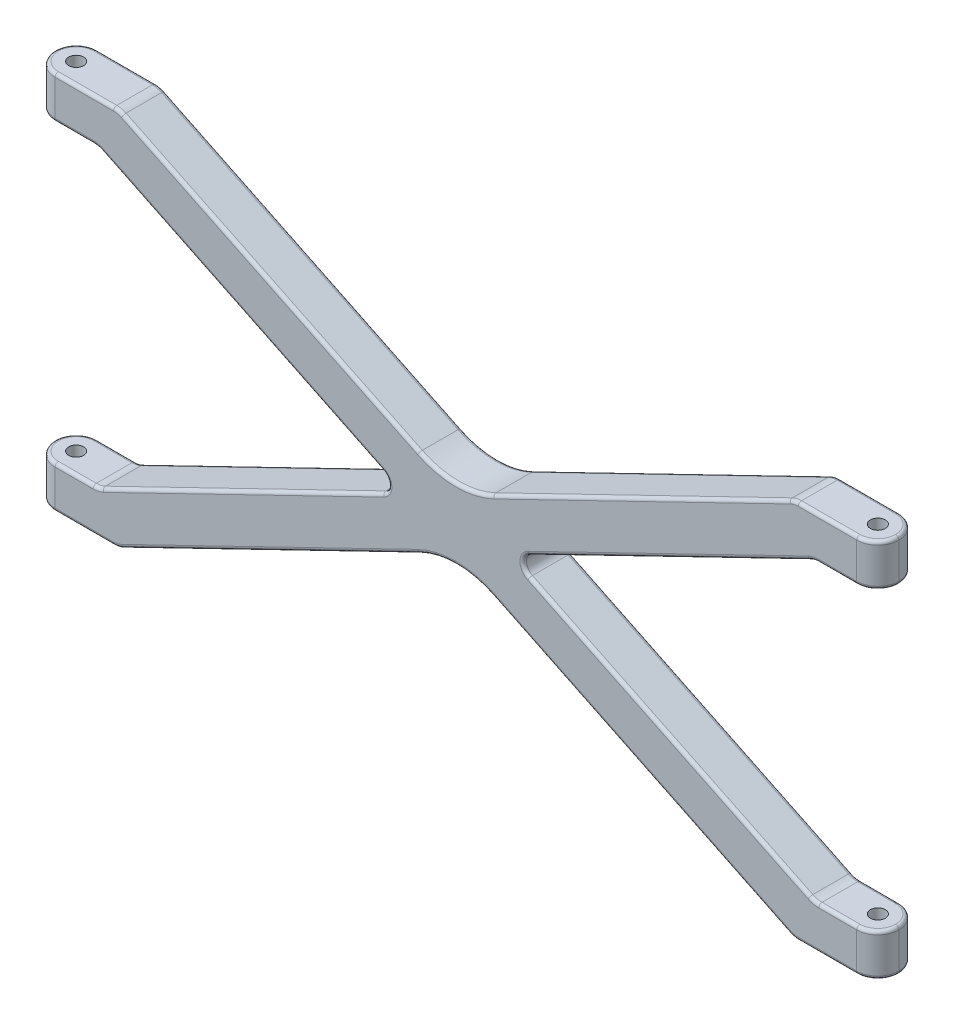
from build123d import *

# Parameters (mm, degrees)
BOSS_EXTRUDE1_DEPTH = 12.7
FILLET1_R           = 6.35
SKETCH2_R           = 2.25
CUT_EXTRUDE1_DEPTH  = 172.332367053
FILLET4_R           = 25.4
FILLET5_R           = 3.175
FILLET2_R           = 6.35
FILLET3_R           = 1


with BuildPart() as part:
    # Sketch1 → Boss-Extrude1 (new body)
    with BuildSketch(Plane.XY):
        Polygon((-107.763073453, 44.45), (-16.166728817, 0), (0, 7.845412377), (-101.6, 57.15), (-127, 57.15), (-127, 44.45), align=None)
        Polygon((0, 7.845412377), (16.166728817, 0), (107.763073453, 44.45), (127, 44.45), (127, 57.15), (101.6, 57.15), align=None)
        Polygon((0, -7.845412377), (101.6, -57.15), (127, -57.15), (127, -44.45), (107.763073453, -44.45), (16.166728817, 0), align=None)
        Polygon((-101.6, -57.15), (0, -7.845412377), (-16.166728817, 0), (-107.763073453, -44.45), (-127, -44.45), (-127, -57.15), align=None)
        Polygon((-16.166728817, 0), (0, -7.845412377), (16.166728817, 0), (0, 7.845412377), align=None)
    extrude(amount=BOSS_EXTRUDE1_DEPTH)

    # Fillet1
    fillet1_edges = [part.edges().sort_by_distance(p)[0] for p in [
        (127, -50.8, 0),
        (127, -50.8, 12.7),
        (127, 50.8, 0),
        (127, 50.8, 12.7),
        (-127, 50.8, 0),
        (-127, 50.8, 12.7),
        (-127, -50.8, 0),
        (-127, -50.8, 12.7),
    ]]
    fillet(fillet1_edges, radius=FILLET1_R - 0.0001)  # a hair under: the kernel refuses the full size

    # Sketch2 → Cut-Extrude1 (cut, through all)
    with BuildSketch(Plane.XZ.offset(57.15)):
        with Locations((-120.65, 6.35)):
            Circle(SKETCH2_R)
        with Locations((120.65, 6.35)):
            Circle(SKETCH2_R)
    extrude(amount=-CUT_EXTRUDE1_DEPTH, mode=Mode.SUBTRACT)

    # Fillet4
    fillet4_edges = [part.edges().sort_by_distance(p)[0] for p in [
        (0, 7.845412377, 6.35),
        (0, -7.845412377, 6.35),
    ]]
    fillet(fillet4_edges, radius=FILLET4_R)

    # Fillet5
    fillet5_edges = [part.edges().sort_by_distance(p)[0] for p in [
        (16.166728817, 0, 6.35),
        (-16.166728817, 0, 6.35),
    ]]
    fillet(fillet5_edges, radius=FILLET5_R)

    # Fillet2
    fillet2_edges = [part.edges().sort_by_distance(p)[0] for p in [
        (-101.6, 57.15, 6.35),
        (101.6, 57.15, 6.35),
        (107.763073453, 44.45, 6.35),
        (107.763073453, -44.45, 6.35),
        (101.6, -57.15, 6.35),
        (-101.6, -57.15, 6.35),
        (-107.763073453, -44.45, 6.35),
        (-107.763073453, 44.45, 6.35),
    ]]
    fillet(fillet2_edges, radius=FILLET2_R)

    # Fillet3
    fillet3_edges = [part.edges().sort_by_distance(p)[0] for p in [
        (-55.68820139, 34.869859277, 0),
        (-55.68820139, 34.869859277, 12.7),
        (55.68820139, 34.869859277, 0),
        (55.68820139, 34.869859277, 12.7),
        (0, 10.678263766, 0),
        (0, 10.678263766, 12.7),
        (0, -10.678263766, 0),
        (0, -10.678263766, 12.7),
        (64.25148447, 23.334636303, 0),
        (64.25148447, 23.334636303, 12.7),
        (-64.25148447, 23.334636303, 0),
        (-64.25148447, 23.334636303, 12.7),
        (20.264017866, 0, 0),
        (20.264017866, 0, 12.7),
        (-20.264017866, 0, 0),
        (-20.264017866, 0, 12.7),
        (-55.68820139, -34.869859277, 0),
        (-55.68820139, -34.869859277, 12.7),
        (111.854743004, -57.15, 0),
        (55.68820139, -34.869859277, 0),
        (-111.854743004, -57.15, 0),
        (-64.25148447, -23.334636303, 0),
        (-111.854743004, 57.15, 0),
        (111.854743004, 57.15, 0),
        (64.25148447, -23.334636303, 0),
        (-101.637079319, 56.988662512, 0),
        (101.637079319, 56.988662512, 0),
        (101.637079319, -56.988662512, 0),
        (-101.637079319, -56.988662512, 0),
        (-111.854743004, -57.15, 12.7),
        (111.854743004, -57.15, 12.7),
        (64.25148447, -23.334636303, 12.7),
        (111.854743004, 57.15, 12.7),
        (-111.854743004, 57.15, 12.7),
        (-64.25148447, -23.334636303, 12.7),
        (55.68820139, -34.869859277, 12.7),
        (-101.637079319, 56.988662512, 12.7),
        (101.637079319, 56.988662512, 12.7),
        (101.637079319, -56.988662512, 12.7),
        (-101.637079319, -56.988662512, 12.7),
        (107.800152771, -44.288662512, 0),
        (107.800152771, -44.288662512, 12.7),
        (107.800152771, 44.288662512, 0),
        (107.800152771, 44.288662512, 12.7),
        (-107.800152771, -44.288662512, 0),
        (-107.800152771, -44.288662512, 12.7),
        (-107.800152771, 44.288662512, 0),
        (-107.800152771, 44.288662512, 12.7),
        (114.93627973, -44.45, 0),
        (114.93627973, -44.45, 12.7),
        (125.14015735, -44.45, 10.84015735),
        (125.14015735, -44.45, 1.85984265),
        (114.93627973, 44.45, 0),
        (-114.93627973, -44.45, 0),
        (-114.93627973, 44.45, 0),
        (125.14015735, -57.15, 10.84015735),
        (125.14015735, -57.15, 1.85984265),
        (-114.93627973, 44.45, 12.7),
        (-114.93627973, -44.45, 12.7),
        (114.93627973, 44.45, 12.7),
        (125.14015735, 44.45, 10.84015735),
        (125.14015735, 44.45, 1.85984265),
        (125.14015735, 57.15, 10.84015735),
        (125.14015735, 57.15, 1.85984265),
        (-125.14015735, 44.45, 1.85984265),
        (-125.14015735, 44.45, 10.84015735),
        (-125.14015735, 57.15, 1.85984265),
        (-125.14015735, 57.15, 10.84015735),
        (-125.14015735, -44.45, 10.84015735),
        (-125.14015735, -44.45, 1.85984265),
        (-125.14015735, -57.15, 10.84015735),
        (-125.14015735, -57.15, 1.85984265),
    ]]
    fillet(fillet3_edges, radius=FILLET3_R)


solid = part.part
